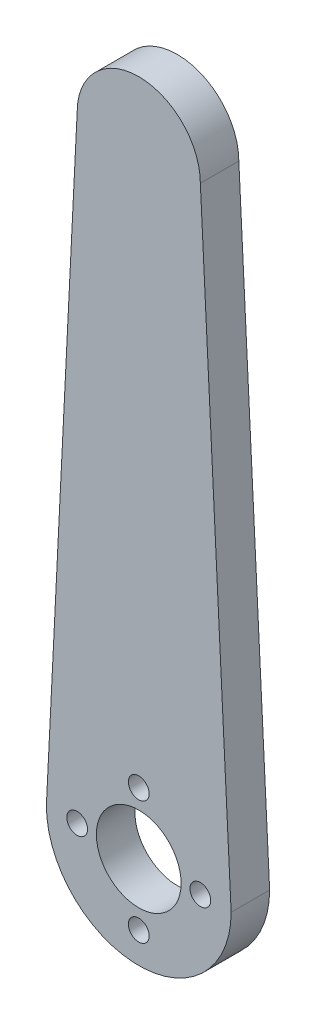
from build123d import *

# Parameters (mm, degrees)
BOSS_EXTRU_1_DEPTH           = 5
ENL_V_MAT_EXTRU_1_DEPTH      = 89.955044826
ENL_V_MAT_EXTRU_1_DEPTH_BACK = 89.955044826
ESQUISSE2_R                  = 5.5
ESQUISSE2_R_2                = 1.35


with BuildPart() as part:
    # Esquisse1 → Boss.-Extru.1 (new body)
    with BuildSketch(Plane.XY):
        with BuildLine():
            Line((12, 0), (8, 80))
            ThreePointArc((8, 80), (0, 88), (-8, 80))
            Line((-8, 80), (-12, 0))
            ThreePointArc((-12, 0), (0, -12), (12, 0))
        make_face()
    extrude(amount=BOSS_EXTRU_1_DEPTH)

    # Esquisse2 → Enlèv. mat.-Extru.1 (cut, two sides: drawn at the far end of the back side and taken through both)
    with BuildSketch(Plane.XY.offset(5).offset(-ENL_V_MAT_EXTRU_1_DEPTH_BACK)):
        Circle(ESQUISSE2_R)
        with Locations((8, 0)):
            Circle(ESQUISSE2_R_2)
        with Locations((0, -8)):
            Circle(ESQUISSE2_R_2)
        with Locations((-8, 0)):
            Circle(ESQUISSE2_R_2)
        with Locations((0, 8)):
            Circle(ESQUISSE2_R_2)
    extrude(amount=ENL_V_MAT_EXTRU_1_DEPTH + ENL_V_MAT_EXTRU_1_DEPTH_BACK, mode=Mode.SUBTRACT)


solid = part.part
